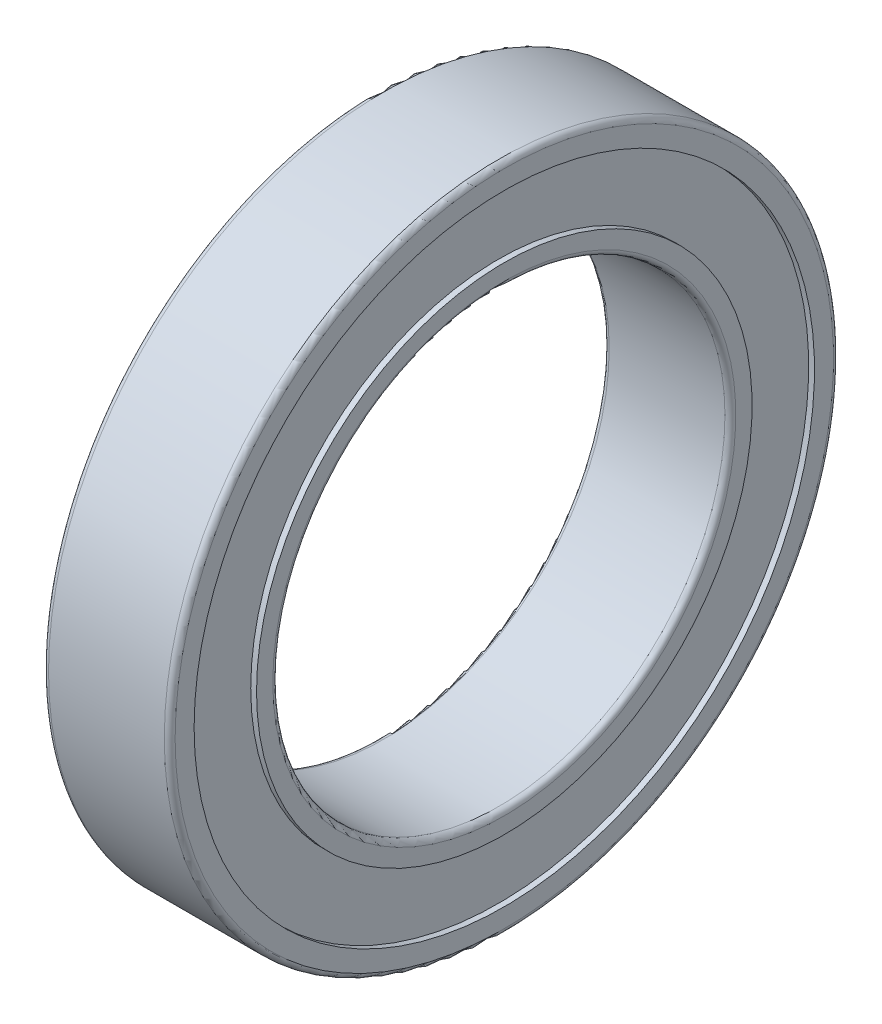
from build123d import *

# Parameters (mm, degrees)
FILLET1_R = 0.3
FILLET2_R = 0.3


with BuildPart() as part:
    # Sketch1 → Revolve1 (revolve)
    with BuildSketch(Plane.XY):
        Polygon((0, 12.5), (7, 12.5), (7, 13.7), (6.68, 13.7), (6.68, 17.15), (7, 17.15), (7, 18.5), (0, 18.5), (0, 17.15), (0.32, 17.15), (0.32, 13.7), (0, 13.7), align=None)
    revolve(axis=Axis((0, 0, 0), (1, 0, 0)))

    # Fillet1
    fillet1_edges = [part.edges().sort_by_distance(p)[0] for p in [
        (7, -18.5, 0),
        (0, -18.5, 0),
    ]]
    fillet(fillet1_edges, radius=FILLET1_R)

    # Fillet2
    fillet2_edges = [part.edges().sort_by_distance(p)[0] for p in [
        (7, -12.5, 0),
        (0, -12.5, 0),
    ]]
    fillet(fillet2_edges, radius=FILLET2_R)


solid = part.part
